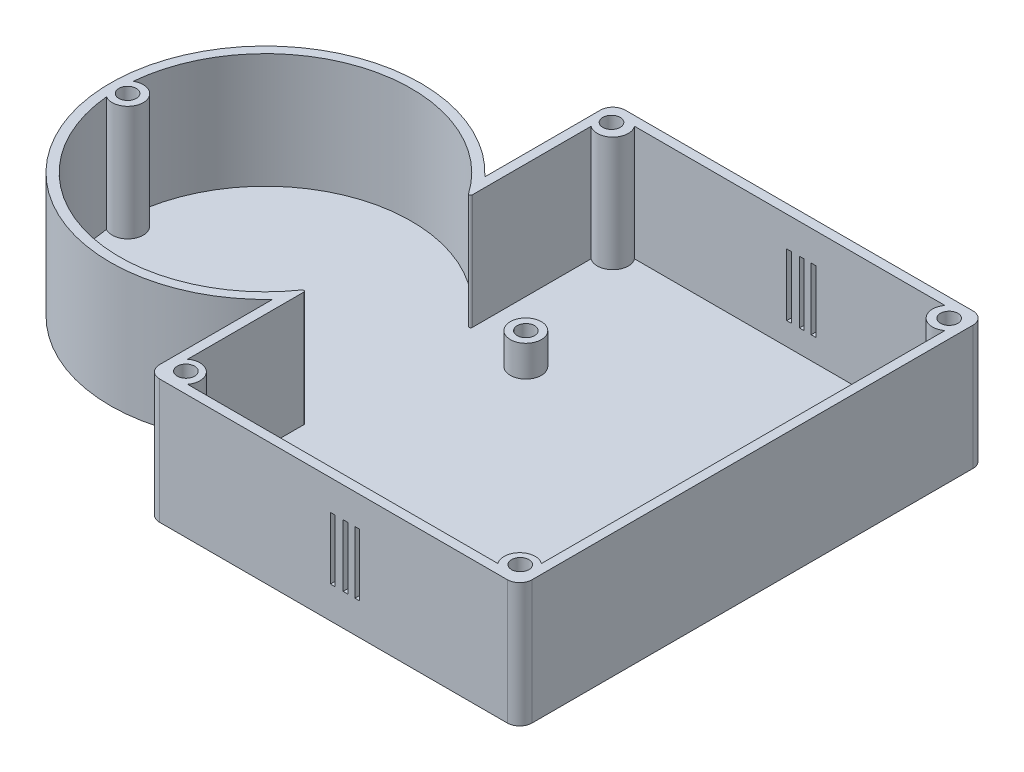
from build123d import *

# Parameters (mm, degrees)
SKETCH8_W                      = 120
SKETCH8_H                      = 150
BOSS_EXTRUDE3_DEPTH            = 40
SKETCH9_R                      = 50
BOSS_EXTRUDE4_DEPTH            = 40
SHELL1_START                   = 3
SHELL1_DEPTH                   = 37
SKETCH17_R                     = 5
BOSS_EXTRUDE6_DEPTH            = 10
CUT_EXTRUDE9_DEPTH             = 203.818558951
CUT_EXTRUDE9_DEPTH_BACK        = 203.818558951
SKETCH11_W                     = 1.5
SKETCH11_H                     = 20
CUT_EXTRUDE10_DEPTH            = 205.88547515
CUT_EXTRUDE10_DEPTH_BACK       = 205.88547515
SKETCH12_W                     = 1.5
SKETCH12_H                     = 20
CUT_EXTRUDE11_DEPTH            = 203.818558951
CUT_EXTRUDE11_DEPTH_BACK       = 203.818558951
SKETCH15_W                     = 1.5
SKETCH15_H                     = 20
SKETCH28_R                     = 5
BOSS_EXTRUDE7_DEPTH            = 37
SKETCH29_R                     = 5
BOSS_EXTRUDE8_DEPTH            = 40
SKETCH30_R                     = 5
BOSS_EXTRUDE9_DEPTH            = 40
SKETCH31_R                     = 5
BOSS_EXTRUDE10_DEPTH           = 37
SKETCH32_R                     = 5
BOSS_EXTRUDE11_DEPTH           = 37
F_2_0_221_DIAMETER_HOLE1_D     = 5.6134
F_2_0_221_DIAMETER_HOLE1_DEPTH = 8
F_2_0_221_DIAMETER_HOLE1_TIP   = 1.686435499
F_2_0_221_DIAMETER_HOLE2_D     = 5.6134
F_2_0_221_DIAMETER_HOLE2_DEPTH = 8
F_2_0_221_DIAMETER_HOLE2_TIP   = 1.686435499
FILLET3_R                      = 4
FILLET2_R                      = 0.5


# Read off the part's stored shape, not the designer's step: Shell1
with BuildPart() as part:
    # Sketch8 → Boss-Extrude3 (new body)
    with BuildSketch(Plane(origin=(0, 0, 0), x_dir=(1, 0, 0), z_dir=(0, 1, 0))):
        with Locations((73.708855083, 72.164227744)):
            Rectangle(SKETCH8_W, SKETCH8_H)
    extrude(amount=BOSS_EXTRUDE3_DEPTH)

    # Sketch9 → Boss-Extrude4 (add)
    with BuildSketch(Plane(origin=(0, 0, 0), x_dir=(1, 0, 0), z_dir=(0, 1, 0))):
        with Locations((-22.779007595, 71.748458752)):
            Circle(SKETCH9_R)
    extrude(amount=BOSS_EXTRUDE4_DEPTH)

    # Shell1 outline → Shell1 (cut)
    with BuildSketch(Plane(origin=(0, 0, 0), x_dir=(1, 0, 0), z_dir=(0, 1, 0)).offset(SHELL1_START)):
        with BuildLine():
            Line((16.708855083, 46.259074664), (16.708855083, 0.164227744))
            Line((16.708855083, 0.164227744), (130.708855083, 0.164227744))
            Line((130.708855083, 0.164227744), (130.708855083, 144.164227744))
            Line((130.708855083, 144.164227744), (16.708855083, 144.164227744))
            Line((16.708855083, 144.164227744), (16.708855083, 97.237842839))
            ThreePointArc((16.708855083, 97.237842839), (-69.779007595, 71.748458751), (16.708855083, 46.259074664))
        make_face()
    extrude(amount=SHELL1_DEPTH, mode=Mode.SUBTRACT)

    # Sketch17 → Boss-Extrude6 (add)
    with BuildSketch(Plane(origin=(1.848761015, 3, -2.465014687), x_dir=(1, 0, 0), z_dir=(0, 1, 0))):
        with Locations(Location((111.867013496, 11.175325825, 0), (0, 0, 270))):
            Circle(SKETCH17_R)
        with Locations(Location((34.367013496, 11.175325825, 0), (0, 0, 270))):
            Circle(SKETCH17_R)
        with Locations(Location((111.867013496, 94.175325825, 0), (0, 0, 270))):
            Circle(SKETCH17_R)
        with Locations(Location((34.367013496, 94.175325825, 0), (0, 0, 270))):
            Circle(SKETCH17_R)
    extrude(amount=BOSS_EXTRUDE6_DEPTH)

    # Sketch11 → Cut-Extrude9 (cut, two sides: drawn at the far end of the back side and taken through both)
    with BuildSketch(Plane.XY.offset(-CUT_EXTRUDE9_DEPTH_BACK)):
        with Locations((73.491480368, 20.290686907)):
            Rectangle(SKETCH11_W, SKETCH11_H)
    extrude(amount=CUT_EXTRUDE9_DEPTH + CUT_EXTRUDE9_DEPTH_BACK, mode=Mode.SUBTRACT)

    # Sketch12 → Cut-Extrude10 (cut, two sides: drawn at the far end of the back side and taken through both)
    with BuildSketch(Plane.XY.offset(2.835772256).offset(-CUT_EXTRUDE10_DEPTH_BACK)):
        with Locations((77.588922832, 20.290686907)):
            Rectangle(SKETCH12_W, SKETCH12_H)
    extrude(amount=CUT_EXTRUDE10_DEPTH + CUT_EXTRUDE10_DEPTH_BACK, mode=Mode.SUBTRACT)

    # Sketch15 → Cut-Extrude11 (cut, two sides: drawn at the far end of the back side and taken through both)
    with BuildSketch(Plane.XY.offset(-CUT_EXTRUDE11_DEPTH_BACK)):
        with Locations((81.379057112, 20.290686907)):
            Rectangle(SKETCH15_W, SKETCH15_H)
    extrude(amount=CUT_EXTRUDE11_DEPTH + CUT_EXTRUDE11_DEPTH_BACK, mode=Mode.SUBTRACT)

    # Sketch28 → Boss-Extrude7 (add)
    with BuildSketch(Plane(origin=(0, 3, 0), x_dir=(1, 0, 0), z_dir=(0, 1, 0))):
        with Locations((19.708855083, 141.164227744)):
            Circle(SKETCH28_R)
    extrude(amount=BOSS_EXTRUDE7_DEPTH)

    # Sketch29 → Boss-Extrude8 (add)
    with BuildSketch(Plane(origin=(0, 0, 0), x_dir=(1, 0, 0), z_dir=(0, 1, 0))):
        with Locations((19.708855083, 3.164227744)):
            Circle(SKETCH29_R)
    extrude(amount=BOSS_EXTRUDE8_DEPTH)

    # Sketch30 → Boss-Extrude9 (add)
    with BuildSketch(Plane(origin=(0, 0, 0), x_dir=(1, 0, 0), z_dir=(0, 1, 0))):
        with Locations((127.708855083, 141.164227744)):
            Circle(SKETCH30_R)
    extrude(amount=BOSS_EXTRUDE9_DEPTH)

    # Sketch31 → Boss-Extrude10 (add)
    with BuildSketch(Plane(origin=(0, 3, 0), x_dir=(1, 0, 0), z_dir=(0, 1, 0))):
        with Locations((127.708855083, 3.164227744)):
            Circle(SKETCH31_R)
    extrude(amount=BOSS_EXTRUDE10_DEPTH)

    # Sketch32 → Boss-Extrude11 (add)
    with BuildSketch(Plane(origin=(0, 3, 0), x_dir=(1, 0, 0), z_dir=(0, 1, 0))):
        with Locations((-67.018543515, 71.628998297)):
            Circle(SKETCH32_R)
    extrude(amount=BOSS_EXTRUDE11_DEPTH)

    # #2 (0.221) Diameter Hole1
    with Locations(Plane(origin=(0, 40, 0), x_dir=(1, 0, 0), z_dir=(0, 1, 0))):
        with Locations((18.917123201, 141.531370062), (127.969984407, 141.269223761), (127.602547564, 3.45328248), (19.774147178, 3.570575466), (-67.115618064, 71.668740496)):
            Hole(F_2_0_221_DIAMETER_HOLE1_D / 2, depth=F_2_0_221_DIAMETER_HOLE1_DEPTH)
            with Locations((0, 0, -(F_2_0_221_DIAMETER_HOLE1_DEPTH + F_2_0_221_DIAMETER_HOLE1_TIP / 2))):  # 118° drill point
                Cone(0, F_2_0_221_DIAMETER_HOLE1_D / 2, F_2_0_221_DIAMETER_HOLE1_TIP, mode=Mode.SUBTRACT)

    # #2 (0.221) Diameter Hole2
    with Locations(Plane(origin=(0, 13, 0), x_dir=(1, 0, 0), z_dir=(0, 1, 0))):
        with Locations((113.866576204, 96.665654076), (36.269140625, 13.672370328), (113.866576204, 13.415425177), (36.224664422, 96.637257854)):
            Hole(F_2_0_221_DIAMETER_HOLE2_D / 2, depth=F_2_0_221_DIAMETER_HOLE2_DEPTH)
            with Locations((0, 0, -(F_2_0_221_DIAMETER_HOLE2_DEPTH + F_2_0_221_DIAMETER_HOLE2_TIP / 2))):  # 118° drill point
                Cone(0, F_2_0_221_DIAMETER_HOLE2_D / 2, F_2_0_221_DIAMETER_HOLE2_TIP, mode=Mode.SUBTRACT)

    # Fillet3
    fillet3_edges = [part.edges().sort_by_distance(p)[0] for p in [
        (13.708855083, 20, -147.164227744),
        (133.708855083, 20, -147.164227744),
        (133.708855083, 20, 2.835772256),
        (13.708855083, 20, 2.835772256),
    ]]
    fillet(fillet3_edges, radius=FILLET3_R)

    # Fillet2
    fillet2_edges = [part.edges().sort_by_distance(p)[0] for p in [
        (16.708855083, 21.5, -46.259074664),
        (16.708855083, 21.5, -97.237842839),
    ]]
    fillet(fillet2_edges, radius=FILLET2_R)


solid = part.part
